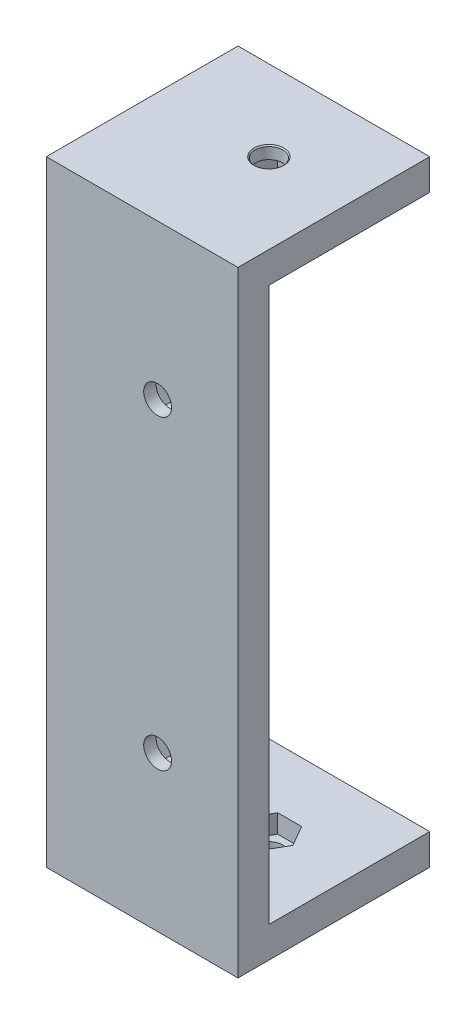
from build123d import *

# Parameters (mm, degrees)
RESSALTO_EXTRUS_O1_DEPTH          = 99.5
FURO_COM_FOLGA_DE_M43_D           = 4.5
FURO_COM_FOLGA_DE_M43_ON_FACE_2_D = 4.5
NERVURA4_START                    = -5
NERVURA4_OUTLINE_W                = 26
NERVURA4_OUTLINE_H                = 26
NERVURA4_DEPTH                    = 5
CORTE_EXTRUS_O3_DEPTH             = 3
CORTE_EXTRUS_O4_DEPTH             = 3
FURO_COM_FOLGA_DE_M42_D           = 4.5
FURO_COM_FOLGA_DE_M42_CSINK_D     = 4.85
FURO_COM_FOLGA_DE_M42_CSINK_ANGLE = 90
CORTE_EXTRUS_O5_DEPTH             = 3
CORTE_EXTRUS_O6_DEPTH             = 3


# Read off the part's stored shape, not the designer's step: Nervura4
with BuildPart() as part:
    # Esboço1 → Ressalto-extrusão1 (new body)
    with BuildSketch(Plane(origin=(0, 0, 0), x_dir=(1, 0, 0), z_dir=(0, 1, 0))):
        Polygon((0, 0), (31, 0), (31, 5), (5, 5), (5, 31), (0, 31), align=None)
    extrude(amount=RESSALTO_EXTRUS_O1_DEPTH)

    # Furo com folga de M43 (through all)
    with Locations(Plane(origin=(0, 84.5, -18), x_dir=(0, 0, -1), z_dir=(-1, 0, 0))):
        with Locations((0, 0), (0, 69.5)):
            Hole(FURO_COM_FOLGA_DE_M43_D / 2)

    # Furo com folga de M43 on face 2 (through all)
    with Locations(Plane(origin=(18, 74.5, 0), x_dir=(1, 0, 0), z_dir=(0, 0, 1))):
        with Locations((0, 0), (0, -49.5)):
            Hole(FURO_COM_FOLGA_DE_M43_ON_FACE_2_D / 2)

    # Nervura4 outline → Nervura4 (add)
    with BuildSketch(Plane(origin=(0, 99.5, 0), x_dir=(1, 0, 0), z_dir=(0, 1, 0)).offset(NERVURA4_START)):
        with Locations((18, 18)):
            Rectangle(NERVURA4_OUTLINE_W, NERVURA4_OUTLINE_H)
    nervura4 = extrude(amount=NERVURA4_DEPTH)

    # Esboço17 → Corte-extrusão3 (cut)
    with BuildSketch(Plane(origin=(0, 0, -5), x_dir=(-1, 0, 0), z_dir=(0, 0, -1))):
        Polygon((-16.065876598, 77.85), (-19.934123402, 77.85), (-21.868246804, 74.5), (-19.934123402, 71.15), (-16.065876598, 71.15), (-14.131753196, 74.5), align=None)
        Polygon((-14.131753196, 25), (-16.065876598, 28.35), (-19.934123402, 28.35), (-21.868246804, 25), (-19.934123402, 21.65), (-16.065876598, 21.65), align=None)
    extrude(amount=-CORTE_EXTRUS_O3_DEPTH, mode=Mode.SUBTRACT)

    # Esboço18 → Corte-extrusão4 (cut)
    with BuildSketch(Plane(origin=(5, 0, 0), x_dir=(0, 0, -1), z_dir=(1, 0, 0))):
        Polygon((19.934123402, 87.85), (16.065876598, 87.85), (14.131753196, 84.5), (16.065876598, 81.15), (19.934123402, 81.15), (21.868246804, 84.5), align=None)
        Polygon((21.868246804, 15), (19.934123402, 18.35), (16.065876598, 18.35), (14.131753196, 15), (16.065876598, 11.65), (19.934123402, 11.65), align=None)
    extrude(amount=-CORTE_EXTRUS_O4_DEPTH, mode=Mode.SUBTRACT)

    # Espelhar1: Nervura4 across plane
    add(nervura4.mirror(Plane(origin=(0, 49.75, 0), x_dir=(0, 0, 1), z_dir=(0, -1, 0))))

    # Furo com folga de M42 (through all)
    with Locations(Plane(origin=(0, 99.5, 0), x_dir=(1, 0, 0), z_dir=(0, 1, 0))):
        with Locations((18, 18)):
            CounterSinkHole(FURO_COM_FOLGA_DE_M42_D / 2, FURO_COM_FOLGA_DE_M42_CSINK_D / 2, counter_sink_angle=FURO_COM_FOLGA_DE_M42_CSINK_ANGLE)

    # Esboço27 → Corte-extrusão5 (cut)
    with BuildSketch(Plane.XZ.offset(-94.5)):
        Polygon((21.868246804, -18), (19.934123402, -14.65), (16.065876598, -14.65), (14.131753196, -18), (16.065876598, -21.35), (19.934123402, -21.35), align=None)
    extrude(amount=-CORTE_EXTRUS_O5_DEPTH, mode=Mode.SUBTRACT)

    # Esboço28 → Corte-extrusão6 (cut)
    with BuildSketch(Plane(origin=(0, 5, 0), x_dir=(1, 0, 0), z_dir=(0, 1, 0))):
        Polygon((19.934123402, 21.35), (16.065876598, 21.35), (14.131753196, 18), (16.065876598, 14.65), (19.934123402, 14.65), (21.868246804, 18), align=None)
    extrude(amount=-CORTE_EXTRUS_O6_DEPTH, mode=Mode.SUBTRACT)


solid = part.part
